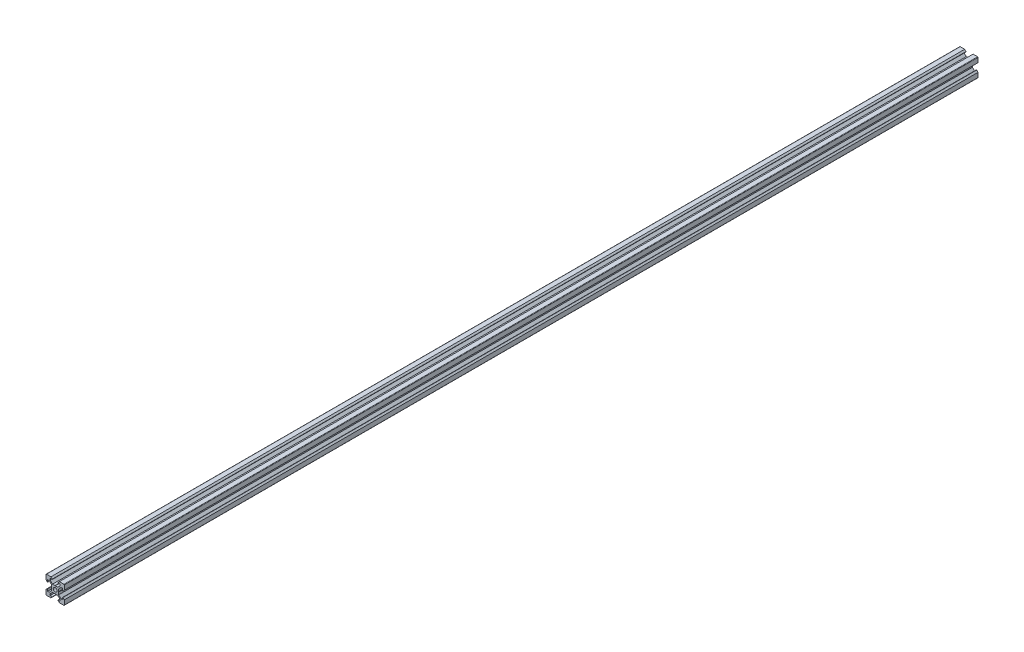
from build123d import *

# Parameters (mm, degrees)
SKETCH1_R           = 2.1
BOSS_EXTRUDE1_DEPTH = 500


with BuildPart() as part:
    # Sketch1 → Boss-Extrude1 (new, symmetric)
    with BuildSketch(Plane.XY):
        with BuildLine():
            Line((4.58, -10), (9.5, -10))
            ThreePointArc((9.5, -10), (9.853553391, -9.853553391), (10, -9.5))
            Line((10, -9.5), (10, -4.58))
            Line((10, -4.58), (8.545, -3.125))
            Line((8.545, -3.125), (8.2, -3.125))
            Line((8.2, -3.125), (8.2, -5.5))
            Line((8.2, -5.5), (6.560660172, -5.5))
            Line((6.560660172, -5.5), (3.9, -2.839339828))
            Line((3.9, -2.839339828), (3.9, -0.21))
            Line((3.9, -0.21), (3.69, 0))
            Line((3.69, 0), (3.9, 0.21))
            Line((3.9, 0.21), (3.9, 2.839339828))
            Line((3.9, 2.839339828), (6.560660172, 5.5))
            Line((6.560660172, 5.5), (8.2, 5.5))
            Line((8.2, 5.5), (8.2, 3.125))
            Line((8.2, 3.125), (8.545, 3.125))
            Line((8.545, 3.125), (10, 4.58))
            Line((10, 4.58), (10, 9.5))
            ThreePointArc((10, 9.5), (9.853553391, 9.853553391), (9.5, 10))
            Line((9.5, 10), (4.58, 10))
            Line((4.58, 10), (3.125, 8.545))
            Line((3.125, 8.545), (3.125, 8.2))
            Line((3.125, 8.2), (5.5, 8.2))
            Line((5.5, 8.2), (5.5, 6.560660172))
            Line((5.5, 6.560660172), (2.839339828, 3.9))
            Line((2.839339828, 3.9), (0.21, 3.9))
            Line((0.21, 3.9), (0, 3.69))
            Line((0, 3.69), (-0.21, 3.9))
            Line((-0.21, 3.9), (-2.839339828, 3.9))
            Line((-2.839339828, 3.9), (-5.5, 6.560660172))
            Line((-5.5, 6.560660172), (-5.5, 8.2))
            Line((-5.5, 8.2), (-3.125, 8.2))
            Line((-3.125, 8.2), (-3.125, 8.545))
            Line((-3.125, 8.545), (-4.58, 10))
            Line((-4.58, 10), (-9.5, 10))
            ThreePointArc((-9.5, 10), (-9.853553391, 9.853553391), (-10, 9.5))
            Line((-10, 9.5), (-10, 4.58))
            Line((-10, 4.58), (-8.545, 3.125))
            Line((-8.545, 3.125), (-8.2, 3.125))
            Line((-8.2, 3.125), (-8.2, 5.5))
            Line((-8.2, 5.5), (-6.560660172, 5.5))
            Line((-6.560660172, 5.5), (-3.9, 2.839339828))
            Line((-3.9, 2.839339828), (-3.9, 0.21))
            Line((-3.9, 0.21), (-3.69, 0))
            Line((-3.69, 0), (-3.9, -0.21))
            Line((-3.9, -0.21), (-3.9, -2.839339828))
            Line((-3.9, -2.839339828), (-6.560660172, -5.5))
            Line((-6.560660172, -5.5), (-8.2, -5.5))
            Line((-8.2, -5.5), (-8.2, -3.125))
            Line((-8.2, -3.125), (-8.545, -3.125))
            Line((-8.545, -3.125), (-10, -4.58))
            Line((-10, -4.58), (-10, -9.5))
            ThreePointArc((-10, -9.5), (-9.853553391, -9.853553391), (-9.5, -10))
            Line((-9.5, -10), (-4.58, -10))
            Line((-4.58, -10), (-3.125, -8.545))
            Line((-3.125, -8.545), (-3.125, -8.2))
            Line((-3.125, -8.2), (-5.5, -8.2))
            Line((-5.5, -8.2), (-5.5, -6.560660172))
            Line((-5.5, -6.560660172), (-2.839339828, -3.9))
            Line((-2.839339828, -3.9), (-0.21, -3.9))
            Line((-0.21, -3.9), (0, -3.69))
            Line((0, -3.69), (0.21, -3.9))
            Line((0.21, -3.9), (2.839339828, -3.9))
            Line((2.839339828, -3.9), (5.5, -6.560660172))
            Line((5.5, -6.560660172), (5.5, -8.2))
            Line((5.5, -8.2), (3.125, -8.2))
            Line((3.125, -8.2), (3.125, -8.545))
            Line((3.125, -8.545), (4.58, -10))
        make_face()
        Circle(SKETCH1_R, mode=Mode.SUBTRACT)
    extrude(amount=BOSS_EXTRUDE1_DEPTH, both=True)


solid = part.part
